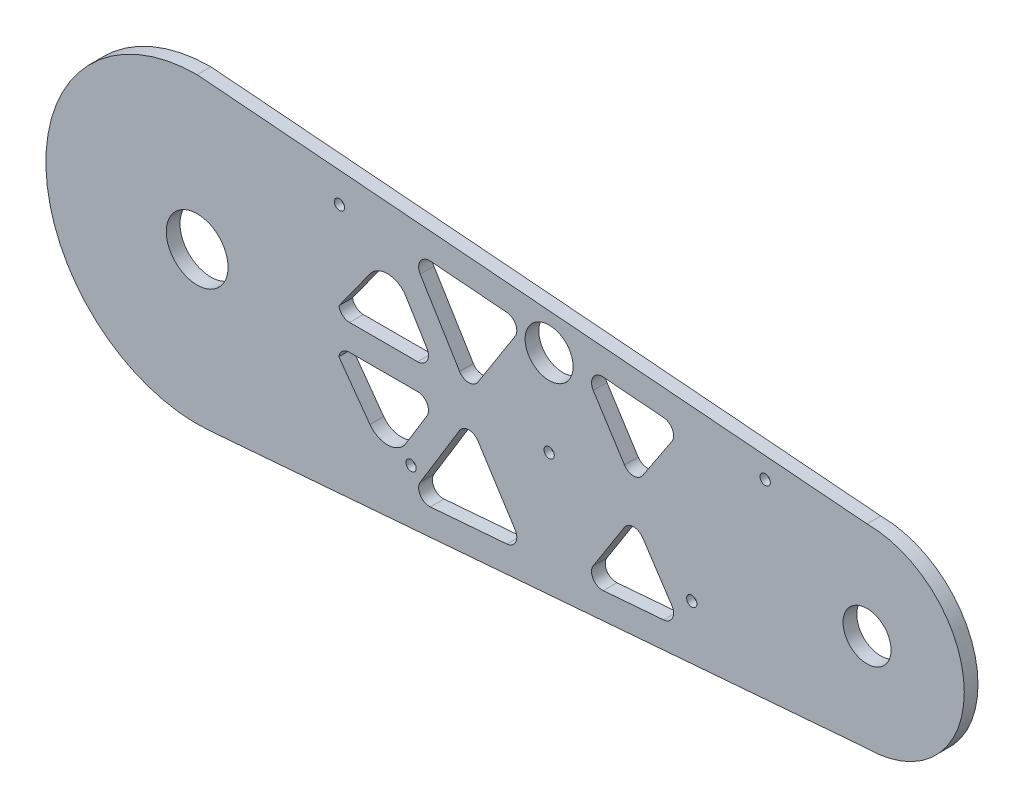
from build123d import *

# Parameters (mm, degrees)
SKETCH1_R             = 14.29385
SKETCH1_R_2           = 11.11
SKETCH1_R_3           = 11.1125
BOSS_EXTRUDE1_DEPTH   = 6.35
CROQUIS1_R            = 2.38125
CORTAR_EXTRUIR1_DEPTH = 50
CROQUIS4_R            = 5
CORTAR_EXTRUIR2_DEPTH = 3.175
CROQUIS5_R            = 5
CORTAR_EXTRUIR3_DEPTH = 3.175
CROQUIS6_R            = 2.38125
CORTAR_EXTRUIR4_DEPTH = 10
CROQUIS7_R            = 2.38125
CORTAR_EXTRUIR5_DEPTH = 10
CROQUIS8_R            = 5
CORTAR_EXTRUIR6_DEPTH = 3.16


with BuildPart() as part:
    # Sketch1 → Boss-Extrude1 (new body)
    with BuildSketch(Plane.XY):
        with BuildLine():
            Line((0, 70), (310, 45))
            ThreePointArc((310, 45), (355, 0), (310, -45))
            Line((310, -45), (5.171398252, -69.808714643))
            ThreePointArc((5.171398252, -69.808714643), (-69.952162315, -2.587467389), (0, 70))
        make_face()
        Circle(SKETCH1_R, mode=Mode.SUBTRACT)
        with Locations((310, 0)):
            Circle(SKETCH1_R_2, mode=Mode.SUBTRACT)
        with Locations((162.878542763, 40)):
            Circle(SKETCH1_R_3, mode=Mode.SUBTRACT)
        with BuildLine():
            Line((107.898974887, 49.259511156), (143.314248041, 46.40344074))
            ThreePointArc((143.314248041, 46.40344074), (147.389908855, 43.644764005), (147.127454118, 38.730252238))
            Line((147.127454118, 38.730252238), (129.916226305, 11.754586611))
            ThreePointArc((129.916226305, 11.754586611), (125.651076231, 9.444205574), (121.433006579, 11.839462159))
            Line((121.433006579, 11.839462159), (103.228961238, 41.671198203))
            ThreePointArc((103.228961238, 41.671198203), (103.238833139, 46.896293531), (107.898974887, 49.259511156))
        make_face(mode=Mode.SUBTRACT)
        with BuildLine():
            Line((70.523244027, 6), (102.03004784, 6))
            ThreePointArc((102.03004784, 6), (106.3902351, 8.552804247), (106.298140539, 13.604493178))
            Line((106.298140539, 13.604493178), (96.590354482, 29.513051181))
            ThreePointArc((96.590354482, 29.513051181), (88.437172177, 34.296727565), (79.941746192, 30.151166228))
            Line((79.941746192, 30.151166228), (65.58297828, 10.229432452))
            ThreePointArc((65.58297828, 10.229432452), (67.271539685, 7.201787411), (70.523244027, 6))
        make_face(mode=Mode.SUBTRACT)
        with BuildLine():
            Line((219.623774494, 32.810522613), (206.130928429, 12.417497436))
            ThreePointArc((206.130928429, 12.417497436), (201.919524559, 10.176643248), (197.745901529, 12.48710226))
            Line((197.745901529, 12.48710226), (183.296864227, 35.133505128))
            ThreePointArc((183.296864227, 35.133505128), (183.227765467, 40.400743015), (187.913912204, 42.80669363))
            Line((187.913912204, 42.80669363), (215.855795571, 40.553315939))
            ThreePointArc((215.855795571, 40.553315939), (219.949772588, 37.757395035), (219.623774494, 32.810522613))
        make_face(mode=Mode.SUBTRACT)
        with BuildLine():
            Line((96.590354482, -29.513051181), (106.298140539, -13.604493178))
            ThreePointArc((106.298140539, -13.604493178), (106.3902351, -8.552804247), (102.03004784, -6))
            Line((102.03004784, -6), (70.523244027, -6))
            ThreePointArc((70.523244027, -6), (67.271539685, -7.201787411), (65.58297828, -10.229432452))
            Line((65.58297828, -10.229432452), (79.941746192, -30.151166228))
            ThreePointArc((79.941746192, -30.151166228), (88.437172177, -34.296727565), (96.590354482, -29.513051181))
        make_face(mode=Mode.SUBTRACT)
        with BuildLine():
            Line((187.913912204, -42.80669363), (215.855795571, -40.553315939))
            ThreePointArc((215.855795571, -40.553315939), (219.949772588, -37.757395035), (219.623774494, -32.810522613))
            Line((219.623774494, -32.810522613), (206.130928429, -12.417497436))
            ThreePointArc((206.130928429, -12.417497436), (201.919524559, -10.176643248), (197.745901529, -12.48710226))
            Line((197.745901529, -12.48710226), (183.296864227, -35.133505128))
            ThreePointArc((183.296864227, -35.133505128), (183.227765467, -40.400743015), (187.913912204, -42.80669363))
        make_face(mode=Mode.SUBTRACT)
        with BuildLine():
            Line((121.433006579, -11.839462159), (103.228961238, -41.671198203))
            ThreePointArc((103.228961238, -41.671198203), (103.238833139, -46.896293531), (107.898974887, -49.259511156))
            Line((107.898974887, -49.259511156), (143.314248041, -46.40344074))
            ThreePointArc((143.314248041, -46.40344074), (147.389908855, -43.644764005), (147.127454118, -38.730252238))
            Line((147.127454118, -38.730252238), (129.916226305, -11.754586611))
            ThreePointArc((129.916226305, -11.754586611), (125.651076231, -9.444205574), (121.433006579, -11.839462159))
        make_face(mode=Mode.SUBTRACT)
    extrude(amount=BOSS_EXTRUDE1_DEPTH)

    # Croquis1 → Cortar-Extruir1 (cut)
    with BuildSketch(Plane.XY.offset(6.35)):
        with Locations((98.995555235, -37.090103176)):
            Circle(CROQUIS1_R)
        with Locations((228.877351461, -26.519571404)):
            Circle(CROQUIS1_R)
    extrude(amount=-CORTAR_EXTRUIR1_DEPTH, mode=Mode.SUBTRACT)

    # Croquis4 → Cortar-Extruir2 (cut)
    with BuildSketch(Plane(origin=(0, 0, 0), x_dir=(-1, 0, 0), z_dir=(0, 0, -1))):
        with Locations((-228.877351461, -26.519571404)):
            Circle(CROQUIS4_R)
        with Locations((-98.995555235, -37.090103176)):
            Circle(CROQUIS4_R)
    extrude(amount=-CORTAR_EXTRUIR2_DEPTH, mode=Mode.SUBTRACT)

    # Croquis5 → Cortar-Extruir3 (cut)
    with BuildSketch(Plane(origin=(0, 0, 0), x_dir=(-1, 0, 0), z_dir=(0, 0, -1))):
        with Locations((-162.878542763, 0)):
            Circle(CROQUIS5_R)
    extrude(amount=-CORTAR_EXTRUIR3_DEPTH, mode=Mode.SUBTRACT)

    # Croquis6 → Cortar-Extruir4 (cut)
    with BuildSketch(Plane(origin=(0, 0, 0), x_dir=(-1, 0, 0), z_dir=(0, 0, -1))):
        with Locations((-162.878542763, 0)):
            Circle(CROQUIS6_R)
    extrude(amount=-CORTAR_EXTRUIR4_DEPTH, mode=Mode.SUBTRACT)

    # Croquis7 → Cortar-Extruir5 (cut)
    with BuildSketch(Plane(origin=(0, 0, 0), x_dir=(-1, 0, 0), z_dir=(0, 0, -1))):
        with Locations((-65.84135797, 50.868973694)):
            Circle(CROQUIS7_R)
        with Locations((-262.871569638, 39.210126075)):
            Circle(CROQUIS7_R)
    extrude(amount=-CORTAR_EXTRUIR5_DEPTH, mode=Mode.SUBTRACT)

    # Croquis8 → Cortar-Extruir6 (cut)
    with BuildSketch(Plane(origin=(0, 0, 0), x_dir=(-1, 0, 0), z_dir=(0, 0, -1))):
        with Locations((-262.871569638, 39.210126075)):
            Circle(CROQUIS8_R)
        with Locations((-65.84135797, 50.868973694)):
            Circle(CROQUIS8_R)
    extrude(amount=-CORTAR_EXTRUIR6_DEPTH, mode=Mode.SUBTRACT)


solid = part.part
